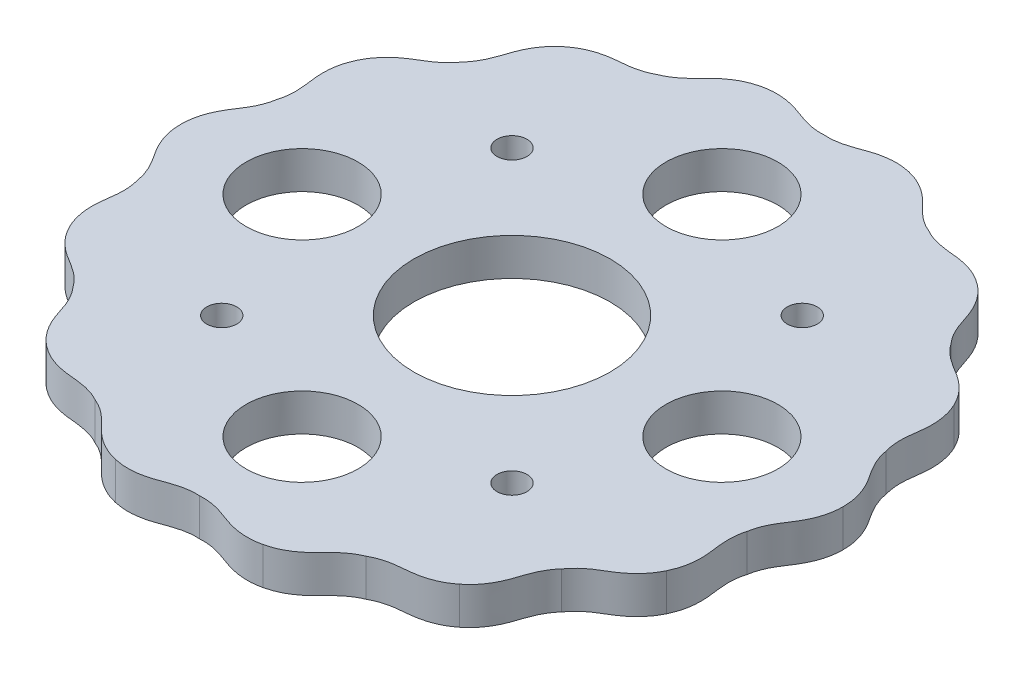
from build123d import *

# Parameters (mm, degrees)
BOSS_EXTRUDE3_DEPTH = 4
SKETCH2_R           = 10.51585
SKETCH2_R_2         = 6
CUT_EXTRUDE1_DEPTH  = 5
SKETCH2_4_R         = 1.607
CUT_EXTRUDE2_DEPTH  = 2.4105


with BuildPart() as part:
    # Sketch1 → Boss-Extrude3 (new body)
    with BuildSketch(Plane(origin=(0, 0, 0), x_dir=(1, 0, 0), z_dir=(0, 1, 0))):
        with BuildLine():
            Line((35.500002326, 0.003735881), (35.500002326, 0))
            Line((35.500002326, 0), (35.500002326, -0.003735881))
            add(Edge.make_bspline(
                [(32.644810899, -7.45096506), (32.674793712, -7.260710929), (32.757965618, -6.873262555), (32.975088878, -6.197475635), (33.30681421, -5.487322542), (33.693887271, -4.83935734), (34.139372051, -4.165162167), (34.499748971, -3.6014921), (34.870711868, -2.889611748), (35.149566879, -2.192738575), (35.418263863, -1.23361479), (35.50061524, -0.495919336), (35.500002326, -0.003735881)],
                knots=[0.02301065, 0.02301065, 0.02301065, 0.02301065, 0.053541567, 0.084072485, 0.145134319, 0.206196153, 0.267257988, 0.389381656, 0.511505325, 0.633628994, 0.755752663, 1, 1, 1, 1], degree=3))
            add(Edge.make_bspline(
                [(31.986017844, -15.399507835), (32.200120458, -14.956331799), (32.445998494, -14.255960238), (32.62005909, -13.275236314), (32.671181344, -12.526384626), (32.645828632, -11.724047822), (32.565707523, -11.059836954), (32.456861927, -10.25911949), (32.389262714, -9.507378309), (32.398512397, -8.723622254), (32.496104055, -8.020553026), (32.589276306, -7.635387164), (32.644810899, -7.45096506)],
                knots=[0.02301065, 0.02301065, 0.02301065, 0.02301065, 0.267257988, 0.389381656, 0.511505325, 0.633628994, 0.755752663, 0.816814497, 0.877876331, 0.938938166, 0.969469083, 1, 1, 1, 1], degree=3))
            Line((31.986017844, -15.399507835), (31.984396906, -15.402873748))
            Line((31.984396906, -15.402873748), (31.982775968, -15.406239661))
            add(Edge.make_bspline(
                [(26.179105738, -20.877140171), (26.288667493, -20.718736177), (26.531710341, -20.405744191), (27.020544594, -19.891087467), (27.62754267, -19.395191866), (28.257425012, -18.979340099), (28.951315253, -18.565199839), (29.520570914, -18.213712342), (30.163670245, -17.733285076), (30.717271866, -17.226414698), (31.375507699, -16.478857279), (31.769777787, -15.849947564), (31.982775968, -15.406239661)],
                knots=[0.02301065, 0.02301065, 0.02301065, 0.02301065, 0.053541567, 0.084072485, 0.145134319, 0.206196153, 0.267257988, 0.389381656, 0.511505325, 0.633628994, 0.755752663, 1, 1, 1, 1], degree=3))
            add(Edge.make_bspline(
                [(22.136810246, -27.752690162), (22.521996911, -27.446297993), (23.047405198, -26.921967502), (23.62974854, -26.113887841), (24.00072267, -25.461376898), (24.326001557, -24.727496287), (24.542005228, -24.094299727), (24.791357022, -23.325651886), (25.05662051, -22.619026286), (25.405013194, -21.916899767), (25.797990545, -21.325799714), (26.049053047, -21.019203188), (26.179105738, -20.877140171)],
                knots=[0.02301065, 0.02301065, 0.02301065, 0.02301065, 0.267257988, 0.389381656, 0.511505325, 0.633628994, 0.755752663, 0.816814497, 0.877876331, 0.938938166, 0.969469083, 1, 1, 1, 1], degree=3))
            Line((22.136810246, -27.752690162), (22.133889416, -27.755019446))
            Line((22.133889416, -27.755019446), (22.130968587, -27.75734873))
            add(Edge.make_bspline(
                [(14.52830762, -30.168341629), (14.695748267, -30.073161626), (15.05052444, -29.89661793), (15.714250068, -29.645025478), (16.476297475, -29.461605575), (17.224233175, -29.360231784), (18.029095404, -29.288171996), (18.694481743, -29.218483478), (19.482343797, -29.064663811), (20.201044438, -28.848188121), (21.118447439, -28.460259983), (21.746546212, -28.06469929), (22.130968587, -27.75734873)],
                knots=[0.02301065, 0.02301065, 0.02301065, 0.02301065, 0.053541567, 0.084072485, 0.145134319, 0.206196153, 0.267257988, 0.389381656, 0.511505325, 0.633628994, 0.755752663, 1, 1, 1, 1], degree=3))
            add(Edge.make_bspline(
                [(7.903135888, -34.609111839), (8.383115662, -34.500188263), (9.083990645, -34.255748926), (9.959276491, -33.780363616), (10.576626521, -33.353431213), (11.188111536, -32.833360849), (11.657457809, -32.356590942), (12.215619812, -31.772252855), (12.761207314, -31.250698702), (13.379739556, -30.769266488), (13.990268616, -30.407210225), (14.349495361, -30.239908237), (14.52830762, -30.168341629)],
                knots=[0.02301065, 0.02301065, 0.02301065, 0.02301065, 0.267257988, 0.389381656, 0.511505325, 0.633628994, 0.755752663, 0.816814497, 0.877876331, 0.938938166, 0.969469083, 1, 1, 1, 1], degree=3))
            Line((7.903135888, -34.609111839), (7.899493673, -34.60994315))
            Line((7.899493673, -34.60994315), (7.895851458, -34.610774462))
            add(Edge.make_bspline(
                [(0, -33.484333037), (0.192155866, -33.471228592), (0.588397592, -33.466099831), (1.295555593, -33.527402621), (2.061719496, -33.692786976), (2.779570716, -33.925969485), (3.535992098, -34.210262493), (4.165721189, -34.43617562), (4.942300224, -34.639429423), (5.683752409, -34.756224087), (6.678619663, -34.804759157), (7.416144457, -34.72089313), (7.895851458, -34.610774462)],
                knots=[0.02301065, 0.02301065, 0.02301065, 0.02301065, 0.053541567, 0.084072485, 0.145134319, 0.206196153, 0.267257988, 0.389381656, 0.511505325, 0.633628994, 0.755752663, 1, 1, 1, 1], degree=3))
            add(Edge.make_bspline(
                [(-7.895851458, -34.610774462), (-7.416144457, -34.72089313), (-6.678619663, -34.804759157), (-5.683752409, -34.756224087), (-4.942300224, -34.639429423), (-4.165721189, -34.43617562), (-3.535992098, -34.210262493), (-2.779570716, -33.925969485), (-2.061719496, -33.692786976), (-1.295555593, -33.527402621), (-0.588397592, -33.466099831), (-0.192155866, -33.471228592), (0, -33.484333037)],
                knots=[0.02301065, 0.02301065, 0.02301065, 0.02301065, 0.267257988, 0.389381656, 0.511505325, 0.633628994, 0.755752663, 0.816814497, 0.877876331, 0.938938166, 0.969469083, 1, 1, 1, 1], degree=3))
            Line((-7.895851458, -34.610774462), (-7.899493673, -34.60994315))
            Line((-7.899493673, -34.60994315), (-7.903135888, -34.609111839))
            add(Edge.make_bspline(
                [(-14.52830762, -30.168341629), (-14.349495361, -30.239908237), (-13.990268616, -30.407210225), (-13.379739556, -30.769266488), (-12.761207314, -31.250698702), (-12.215619812, -31.772252855), (-11.657457809, -32.356590942), (-11.188111536, -32.833360849), (-10.576626521, -33.353431213), (-9.959276491, -33.780363616), (-9.083990645, -34.255748926), (-8.383115662, -34.500188263), (-7.903135888, -34.609111839)],
                knots=[0.02301065, 0.02301065, 0.02301065, 0.02301065, 0.053541567, 0.084072485, 0.145134319, 0.206196153, 0.267257988, 0.389381656, 0.511505325, 0.633628994, 0.755752663, 1, 1, 1, 1], degree=3))
            add(Edge.make_bspline(
                [(-22.130968587, -27.75734873), (-21.746546212, -28.06469929), (-21.118447439, -28.460259983), (-20.201044438, -28.848188121), (-19.482343797, -29.064663811), (-18.694481743, -29.218483478), (-18.029095404, -29.288171996), (-17.224233175, -29.360231784), (-16.476297475, -29.461605575), (-15.714250068, -29.645025478), (-15.05052444, -29.89661793), (-14.695748267, -30.073161626), (-14.52830762, -30.168341629)],
                knots=[0.02301065, 0.02301065, 0.02301065, 0.02301065, 0.267257988, 0.389381656, 0.511505325, 0.633628994, 0.755752663, 0.816814497, 0.877876331, 0.938938166, 0.969469083, 1, 1, 1, 1], degree=3))
            Line((-22.130968587, -27.75734873), (-22.133889416, -27.755019446))
            Line((-22.133889416, -27.755019446), (-22.136810246, -27.752690162))
            add(Edge.make_bspline(
                [(-26.179105738, -20.877140171), (-26.049053047, -21.019203188), (-25.797990545, -21.325799714), (-25.405013194, -21.916899767), (-25.05662051, -22.619026286), (-24.791357022, -23.325651886), (-24.542005228, -24.094299727), (-24.326001557, -24.727496287), (-24.00072267, -25.461376898), (-23.62974854, -26.113887841), (-23.047405198, -26.921967502), (-22.521996911, -27.446297993), (-22.136810246, -27.752690162)],
                knots=[0.02301065, 0.02301065, 0.02301065, 0.02301065, 0.053541567, 0.084072485, 0.145134319, 0.206196153, 0.267257988, 0.389381656, 0.511505325, 0.633628994, 0.755752663, 1, 1, 1, 1], degree=3))
            add(Edge.make_bspline(
                [(-31.982775968, -15.406239661), (-31.769777787, -15.849947564), (-31.375507698, -16.478857279), (-30.717271866, -17.226414698), (-30.163670245, -17.733285076), (-29.520570914, -18.213712342), (-28.951315253, -18.565199839), (-28.257425012, -18.979340099), (-27.62754267, -19.395191866), (-27.020544594, -19.891087467), (-26.531710341, -20.405744191), (-26.288667493, -20.718736177), (-26.179105738, -20.877140171)],
                knots=[0.02301065, 0.02301065, 0.02301065, 0.02301065, 0.267257988, 0.389381656, 0.511505325, 0.633628994, 0.755752663, 0.816814497, 0.877876331, 0.938938166, 0.969469083, 1, 1, 1, 1], degree=3))
            Line((-31.982775968, -15.406239661), (-31.984396906, -15.402873748))
            Line((-31.984396906, -15.402873748), (-31.986017844, -15.399507835))
            add(Edge.make_bspline(
                [(-32.644810899, -7.45096506), (-32.589276306, -7.635387164), (-32.496104055, -8.020553026), (-32.398512397, -8.723622254), (-32.389262714, -9.507378309), (-32.456861927, -10.25911949), (-32.565707523, -11.059836954), (-32.645828632, -11.724047822), (-32.671181344, -12.526384626), (-32.62005909, -13.275236314), (-32.445998494, -14.255960238), (-32.200120458, -14.956331799), (-31.986017844, -15.399507835)],
                knots=[0.02301065, 0.02301065, 0.02301065, 0.02301065, 0.053541567, 0.084072485, 0.145134319, 0.206196153, 0.267257988, 0.389381656, 0.511505325, 0.633628994, 0.755752663, 1, 1, 1, 1], degree=3))
            add(Edge.make_bspline(
                [(-35.500002326, -0.003735881), (-35.50061524, -0.495919336), (-35.418263863, -1.23361479), (-35.149566879, -2.192738575), (-34.870711868, -2.889611748), (-34.499748971, -3.6014921), (-34.139372051, -4.165162167), (-33.693887271, -4.83935734), (-33.30681421, -5.487322542), (-32.975088878, -6.197475635), (-32.757965618, -6.873262555), (-32.674793712, -7.260710929), (-32.644810899, -7.45096506)],
                knots=[0.02301065, 0.02301065, 0.02301065, 0.02301065, 0.267257988, 0.389381656, 0.511505325, 0.633628994, 0.755752663, 0.816814497, 0.877876331, 0.938938166, 0.969469083, 1, 1, 1, 1], degree=3))
            Line((-35.500002326, -0.003735881), (-35.500002326, 0))
            Line((-35.500002326, 0), (-35.500002326, 0.003735881))
            add(Edge.make_bspline(
                [(-32.644810899, 7.45096506), (-32.674793712, 7.260710929), (-32.757965618, 6.873262555), (-32.975088878, 6.197475635), (-33.30681421, 5.487322542), (-33.693887271, 4.83935734), (-34.139372051, 4.165162167), (-34.499748971, 3.6014921), (-34.870711868, 2.889611748), (-35.149566879, 2.192738575), (-35.418263863, 1.23361479), (-35.50061524, 0.495919336), (-35.500002326, 0.003735881)],
                knots=[0.02301065, 0.02301065, 0.02301065, 0.02301065, 0.053541567, 0.084072485, 0.145134319, 0.206196153, 0.267257988, 0.389381656, 0.511505325, 0.633628994, 0.755752663, 1, 1, 1, 1], degree=3))
            add(Edge.make_bspline(
                [(-31.986017844, 15.399507835), (-32.200120458, 14.956331799), (-32.445998494, 14.255960238), (-32.62005909, 13.275236314), (-32.671181344, 12.526384626), (-32.645828632, 11.724047822), (-32.565707523, 11.059836954), (-32.456861927, 10.25911949), (-32.389262714, 9.507378309), (-32.398512397, 8.723622254), (-32.496104055, 8.020553026), (-32.589276306, 7.635387164), (-32.644810899, 7.45096506)],
                knots=[0.02301065, 0.02301065, 0.02301065, 0.02301065, 0.267257988, 0.389381656, 0.511505325, 0.633628994, 0.755752663, 0.816814497, 0.877876331, 0.938938166, 0.969469083, 1, 1, 1, 1], degree=3))
            Line((-31.986017844, 15.399507835), (-31.984396906, 15.402873748))
            Line((-31.984396906, 15.402873748), (-31.982775968, 15.406239661))
            add(Edge.make_bspline(
                [(-26.179105738, 20.877140171), (-26.288667493, 20.718736177), (-26.531710341, 20.405744191), (-27.020544594, 19.891087467), (-27.62754267, 19.395191866), (-28.257425012, 18.979340099), (-28.951315253, 18.565199839), (-29.520570914, 18.213712342), (-30.163670245, 17.733285076), (-30.717271866, 17.226414698), (-31.375507699, 16.478857278), (-31.769777787, 15.849947564), (-31.982775968, 15.406239661)],
                knots=[0.02301065, 0.02301065, 0.02301065, 0.02301065, 0.053541567, 0.084072485, 0.145134319, 0.206196153, 0.267257988, 0.389381656, 0.511505325, 0.633628994, 0.755752663, 1, 1, 1, 1], degree=3))
            add(Edge.make_bspline(
                [(-22.136810246, 27.752690162), (-22.521996911, 27.446297993), (-23.047405198, 26.921967502), (-23.62974854, 26.113887841), (-24.00072267, 25.461376898), (-24.326001557, 24.727496287), (-24.542005228, 24.094299727), (-24.791357022, 23.325651886), (-25.05662051, 22.619026286), (-25.405013194, 21.916899767), (-25.797990545, 21.325799714), (-26.049053047, 21.019203188), (-26.179105738, 20.877140171)],
                knots=[0.02301065, 0.02301065, 0.02301065, 0.02301065, 0.267257988, 0.389381656, 0.511505325, 0.633628994, 0.755752663, 0.816814497, 0.877876331, 0.938938166, 0.969469083, 1, 1, 1, 1], degree=3))
            Line((-22.136810246, 27.752690162), (-22.133889416, 27.755019446))
            Line((-22.133889416, 27.755019446), (-22.130968587, 27.75734873))
            add(Edge.make_bspline(
                [(-14.52830762, 30.168341629), (-14.695748267, 30.073161626), (-15.05052444, 29.89661793), (-15.714250068, 29.645025478), (-16.476297475, 29.461605575), (-17.224233175, 29.360231784), (-18.029095404, 29.288171996), (-18.694481743, 29.218483478), (-19.482343797, 29.064663811), (-20.201044438, 28.848188121), (-21.118447439, 28.460259983), (-21.746546212, 28.06469929), (-22.130968587, 27.75734873)],
                knots=[0.02301065, 0.02301065, 0.02301065, 0.02301065, 0.053541567, 0.084072485, 0.145134319, 0.206196153, 0.267257988, 0.389381656, 0.511505325, 0.633628994, 0.755752663, 1, 1, 1, 1], degree=3))
            add(Edge.make_bspline(
                [(-7.903135888, 34.609111839), (-8.383115662, 34.500188263), (-9.083990645, 34.255748926), (-9.959276491, 33.780363616), (-10.576626521, 33.353431213), (-11.188111536, 32.833360849), (-11.657457809, 32.356590942), (-12.215619812, 31.772252855), (-12.761207314, 31.250698702), (-13.379739556, 30.769266488), (-13.990268616, 30.407210225), (-14.349495361, 30.239908237), (-14.52830762, 30.168341629)],
                knots=[0.02301065, 0.02301065, 0.02301065, 0.02301065, 0.267257988, 0.389381656, 0.511505325, 0.633628994, 0.755752663, 0.816814497, 0.877876331, 0.938938166, 0.969469083, 1, 1, 1, 1], degree=3))
            Line((-7.903135888, 34.609111839), (-7.899493673, 34.60994315))
            Line((-7.899493673, 34.60994315), (-7.895851458, 34.610774462))
            add(Edge.make_bspline(
                [(0, 33.484333037), (-0.192155866, 33.471228592), (-0.588397592, 33.466099831), (-1.295555593, 33.527402621), (-2.061719496, 33.692786976), (-2.779570716, 33.925969485), (-3.535992098, 34.210262493), (-4.165721189, 34.43617562), (-4.942300224, 34.639429423), (-5.683752409, 34.756224087), (-6.678619663, 34.804759157), (-7.416144457, 34.72089313), (-7.895851458, 34.610774462)],
                knots=[0.02301065, 0.02301065, 0.02301065, 0.02301065, 0.053541567, 0.084072485, 0.145134319, 0.206196153, 0.267257988, 0.389381656, 0.511505325, 0.633628994, 0.755752663, 1, 1, 1, 1], degree=3))
            add(Edge.make_bspline(
                [(7.895851458, 34.610774462), (7.416144457, 34.72089313), (6.678619663, 34.804759157), (5.683752409, 34.756224087), (4.942300224, 34.639429423), (4.165721189, 34.43617562), (3.535992098, 34.210262493), (2.779570716, 33.925969485), (2.061719496, 33.692786976), (1.295555593, 33.527402621), (0.588397592, 33.466099831), (0.192155866, 33.471228592), (0, 33.484333037)],
                knots=[0.02301065, 0.02301065, 0.02301065, 0.02301065, 0.267257988, 0.389381656, 0.511505325, 0.633628994, 0.755752663, 0.816814497, 0.877876331, 0.938938166, 0.969469083, 1, 1, 1, 1], degree=3))
            Line((7.895851458, 34.610774462), (7.899493673, 34.60994315))
            Line((7.899493673, 34.60994315), (7.903135888, 34.609111839))
            add(Edge.make_bspline(
                [(14.52830762, 30.168341629), (14.349495361, 30.239908237), (13.990268616, 30.407210225), (13.379739556, 30.769266488), (12.761207314, 31.250698702), (12.215619812, 31.772252855), (11.657457809, 32.356590942), (11.188111536, 32.833360849), (10.576626521, 33.353431213), (9.959276491, 33.780363616), (9.083990645, 34.255748926), (8.383115662, 34.500188263), (7.903135888, 34.609111839)],
                knots=[0.02301065, 0.02301065, 0.02301065, 0.02301065, 0.053541567, 0.084072485, 0.145134319, 0.206196153, 0.267257988, 0.389381656, 0.511505325, 0.633628994, 0.755752663, 1, 1, 1, 1], degree=3))
            add(Edge.make_bspline(
                [(22.130968587, 27.75734873), (21.746546212, 28.06469929), (21.118447439, 28.460259983), (20.201044438, 28.848188121), (19.482343797, 29.064663811), (18.694481743, 29.218483478), (18.029095404, 29.288171996), (17.224233175, 29.360231784), (16.476297475, 29.461605575), (15.714250068, 29.645025478), (15.05052444, 29.89661793), (14.695748267, 30.073161626), (14.52830762, 30.168341629)],
                knots=[0.02301065, 0.02301065, 0.02301065, 0.02301065, 0.267257988, 0.389381656, 0.511505325, 0.633628994, 0.755752663, 0.816814497, 0.877876331, 0.938938166, 0.969469083, 1, 1, 1, 1], degree=3))
            Line((22.130968587, 27.75734873), (22.133889416, 27.755019446))
            Line((22.133889416, 27.755019446), (22.136810246, 27.752690162))
            add(Edge.make_bspline(
                [(26.179105738, 20.877140171), (26.049053047, 21.019203188), (25.797990545, 21.325799714), (25.405013194, 21.916899767), (25.05662051, 22.619026286), (24.791357022, 23.325651886), (24.542005228, 24.094299727), (24.326001557, 24.727496287), (24.00072267, 25.461376898), (23.62974854, 26.113887841), (23.047405198, 26.921967502), (22.521996911, 27.446297993), (22.136810246, 27.752690162)],
                knots=[0.02301065, 0.02301065, 0.02301065, 0.02301065, 0.053541567, 0.084072485, 0.145134319, 0.206196153, 0.267257988, 0.389381656, 0.511505325, 0.633628994, 0.755752663, 1, 1, 1, 1], degree=3))
            add(Edge.make_bspline(
                [(31.982775968, 15.406239661), (31.769777787, 15.849947564), (31.375507698, 16.478857279), (30.717271866, 17.226414698), (30.163670245, 17.733285076), (29.520570914, 18.213712342), (28.951315253, 18.565199839), (28.257425012, 18.979340099), (27.62754267, 19.395191866), (27.020544594, 19.891087467), (26.531710341, 20.405744191), (26.288667493, 20.718736177), (26.179105738, 20.877140171)],
                knots=[0.02301065, 0.02301065, 0.02301065, 0.02301065, 0.267257988, 0.389381656, 0.511505325, 0.633628994, 0.755752663, 0.816814497, 0.877876331, 0.938938166, 0.969469083, 1, 1, 1, 1], degree=3))
            Line((31.982775968, 15.406239661), (31.984396906, 15.402873748))
            Line((31.984396906, 15.402873748), (31.986017844, 15.399507835))
            add(Edge.make_bspline(
                [(32.644810899, 7.45096506), (32.589276306, 7.635387164), (32.496104055, 8.020553026), (32.398512397, 8.723622254), (32.389262714, 9.507378309), (32.456861927, 10.25911949), (32.565707523, 11.059836954), (32.645828632, 11.724047822), (32.671181344, 12.526384626), (32.62005909, 13.275236314), (32.445998494, 14.255960238), (32.200120458, 14.956331799), (31.986017844, 15.399507835)],
                knots=[0.02301065, 0.02301065, 0.02301065, 0.02301065, 0.053541567, 0.084072485, 0.145134319, 0.206196153, 0.267257988, 0.389381656, 0.511505325, 0.633628994, 0.755752663, 1, 1, 1, 1], degree=3))
            add(Edge.make_bspline(
                [(35.500002326, 0.003735881), (35.50061524, 0.495919336), (35.418263863, 1.23361479), (35.149566879, 2.192738575), (34.870711868, 2.889611748), (34.499748971, 3.6014921), (34.139372051, 4.165162167), (33.693887271, 4.83935734), (33.30681421, 5.487322542), (32.975088878, 6.197475635), (32.757965618, 6.873262555), (32.674793712, 7.260710929), (32.644810899, 7.45096506)],
                knots=[0.02301065, 0.02301065, 0.02301065, 0.02301065, 0.267257988, 0.389381656, 0.511505325, 0.633628994, 0.755752663, 0.816814497, 0.877876331, 0.938938166, 0.969469083, 1, 1, 1, 1], degree=3))
        make_face()
    extrude(amount=BOSS_EXTRUDE3_DEPTH)

    # Sketch2 → Cut-Extrude1 (cut)
    with BuildSketch(Plane(origin=(0, 4, 0), x_dir=(1, 0, 0), z_dir=(0, 1, 0))):
        Circle(SKETCH2_R)
        with Locations((22.5, 0)):
            Circle(SKETCH2_R_2)
        with Locations((0, -22.5)):
            Circle(SKETCH2_R_2)
        with Locations((-22.5, 0)):
            Circle(SKETCH2_R_2)
        with Locations((0, 22.5)):
            Circle(SKETCH2_R_2)
    extrude(amount=-CUT_EXTRUDE1_DEPTH, mode=Mode.SUBTRACT)

    # Sketch2<4> → Cut-Extrude2 (cut)
    with BuildSketch(Plane(origin=(0, 4, 0), x_dir=(1, 0, 0), z_dir=(0, 1, 0))):
        with Locations((15.556349186, 15.556349186)):
            Circle(SKETCH2_4_R)
        with Locations((15.556349186, -15.556349186)):
            Circle(SKETCH2_4_R)
        with Locations((-15.556349186, -15.556349186)):
            Circle(SKETCH2_4_R)
        with Locations((-15.556349186, 15.556349186)):
            Circle(SKETCH2_4_R)
    extrude(amount=-CUT_EXTRUDE2_DEPTH, mode=Mode.SUBTRACT)


solid = part.part
